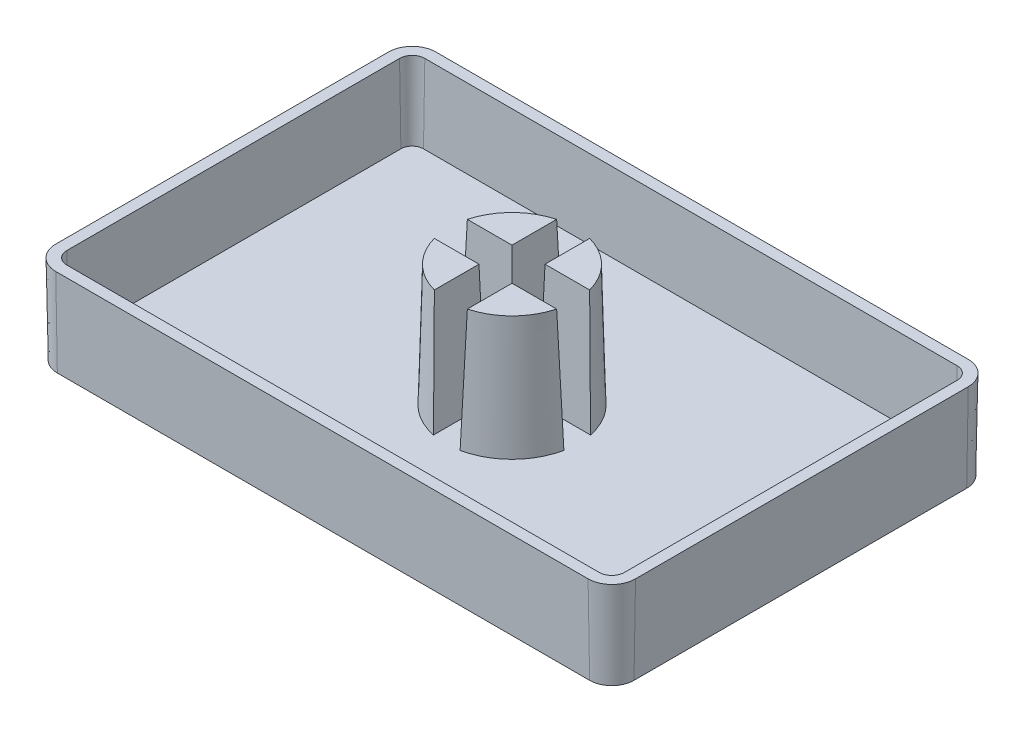
from build123d import *

# Parameters (mm, degrees)
BOSS_EXTRUDE1_DEPTH           = 4
BOSS_EXTRUDE1_DRAFT           = -1
SHELL1_T                      = -0.5
BOSS_EXTRUDE2_DEPTH           = 5.5
BOSS_EXTRUDE2_DRAFT           = 1.5
BOSS_EXTRUDE2_PROFILE_2_DEPTH = 5.5
BOSS_EXTRUDE2_PROFILE_2_DRAFT = 1.5
BOSS_EXTRUDE2_PROFILE_3_DEPTH = 5.5
BOSS_EXTRUDE2_PROFILE_3_DRAFT = 1.5
BOSS_EXTRUDE2_PROFILE_4_DEPTH = 5.5
BOSS_EXTRUDE2_PROFILE_4_DRAFT = 1.5


with BuildPart() as part:
    # Sketch1 → Boss-Extrude1 (with draft: the straight prism first)
    with BuildSketch(Plane(origin=(0, 0, 0), x_dir=(1, 0, 0), z_dir=(0, 1, 0))):
        with BuildLine():
            Line((-12, -8.5), (12, -8.5))
            ThreePointArc((12, -8.5), (12.707106781, -8.207106781), (13, -7.5))
            Line((13, -7.5), (13, 7.5))
            ThreePointArc((13, 7.5), (12.707106781, 8.207106781), (12, 8.5))
            Line((12, 8.5), (-12, 8.5))
            ThreePointArc((-12, 8.5), (-12.707106781, 8.207106781), (-13, 7.5))
            Line((-13, 7.5), (-13, -7.5))
            ThreePointArc((-13, -7.5), (-12.707106781, -8.207106781), (-12, -8.5))
        make_face()
    extrude(amount=BOSS_EXTRUDE1_DEPTH)
    # Boss-Extrude1: the draft: its side faces are tilted about the plane it starts from
    boss_extrude1_sides = [part.faces().sort_by_distance(p)[0] for p in [
        (0, 2, 8.5),
        (12.707106781, 2, 8.207106781),
        (13, 2, 0),
        (12.707106781, 2, -8.207106781),
        (0, 2, -8.5),
        (-12.707106781, 2, -8.207106781),
        (-13, 2, 0),
        (-12.707106781, 2, 8.207106781),
    ]]
    draft(boss_extrude1_sides, Plane(origin=(0, 0, 0), x_dir=(1, 0, 0), z_dir=(0, 1, 0)), BOSS_EXTRUDE1_DRAFT)

    # Shell1
    shell1_openings = [part.faces().sort_by_distance(p)[0] for p in [
        (0, 4, 0),
    ]]
    offset(amount=SHELL1_T, openings=shell1_openings, kind=Kind.INTERSECTION)


with BuildPart() as boss_extrude2_tool:
    # Sketch2 → Boss-Extrude2 (with draft: the straight prism first)
    with BuildSketch(Plane(origin=(0, 0.5, 0), x_dir=(1, 0, 0), z_dir=(0, 1, 0))):
        with BuildLine():
            Line((-0.6, -2.939387691), (-0.6, -0.6))
            Line((-0.6, -0.6), (-2.939387691, -0.6))
            ThreePointArc((-2.939387691, -0.6), (-2.121320344, -2.121320344), (-0.6, -2.939387691))
        make_face()
    extrude(amount=BOSS_EXTRUDE2_DEPTH)
    # Boss-Extrude2: the draft: its side faces are tilted about the plane it starts from
    boss_extrude2_sides = [boss_extrude2_tool.faces().sort_by_distance(p)[0] for p in [
        (-0.6, 3.25, 1.769693846),
        (-1.769693846, 3.25, 0.6),
        (-2.121320344, 3.25, 2.121320344),
    ]]
    draft(boss_extrude2_sides, Plane(origin=(0, 0.5, 0), x_dir=(1, 0, 0), z_dir=(0, 1, 0)), BOSS_EXTRUDE2_DRAFT)


with BuildPart() as part_1:
    add(part.part)

    # Boss-Extrude2: add boss_extrude2_tool
    add(boss_extrude2_tool.part)


with BuildPart() as boss_extrude2_profile_2_tool:
    # Sketch2 → Boss-Extrude2 profile 2 (with draft: the straight prism first)
    with BuildSketch(Plane(origin=(0, 0.5, 0), x_dir=(1, 0, 0), z_dir=(0, 1, 0))):
        with BuildLine():
            ThreePointArc((2.939387691, 0.6), (2.121320344, 2.121320344), (0.6, 2.939387691))
            Line((0.6, 2.939387691), (0.6, 0.6))
            Line((0.6, 0.6), (2.939387691, 0.6))
        make_face()
    extrude(amount=BOSS_EXTRUDE2_PROFILE_2_DEPTH)
    # Boss-Extrude2 profile 2: the draft: its side faces are tilted about the plane it starts from
    boss_extrude2_profile_2_sides = [boss_extrude2_profile_2_tool.faces().sort_by_distance(p)[0] for p in [
        (2.121320344, 3.25, -2.121320344),
        (0.6, 3.25, -1.769693846),
        (1.769693846, 3.25, -0.6),
    ]]
    draft(boss_extrude2_profile_2_sides, Plane(origin=(0, 0.5, 0), x_dir=(1, 0, 0), z_dir=(0, 1, 0)), BOSS_EXTRUDE2_PROFILE_2_DRAFT)


with BuildPart() as part_2:
    add(part_1.part)

    # Boss-Extrude2 profile 2: add boss_extrude2_profile_2_tool
    add(boss_extrude2_profile_2_tool.part)


with BuildPart() as boss_extrude2_profile_3_tool:
    # Sketch2 → Boss-Extrude2 profile 3 (with draft: the straight prism first)
    with BuildSketch(Plane(origin=(0, 0.5, 0), x_dir=(1, 0, 0), z_dir=(0, 1, 0))):
        with BuildLine():
            Line((2.939387691, -0.6), (0.6, -0.6))
            Line((0.6, -0.6), (0.6, -2.939387691))
            ThreePointArc((0.6, -2.939387691), (2.121320344, -2.121320344), (2.939387691, -0.6))
        make_face()
    extrude(amount=BOSS_EXTRUDE2_PROFILE_3_DEPTH)
    # Boss-Extrude2 profile 3: the draft: its side faces are tilted about the plane it starts from
    boss_extrude2_profile_3_sides = [boss_extrude2_profile_3_tool.faces().sort_by_distance(p)[0] for p in [
        (1.769693846, 3.25, 0.6),
        (0.6, 3.25, 1.769693846),
        (2.121320344, 3.25, 2.121320344),
    ]]
    draft(boss_extrude2_profile_3_sides, Plane(origin=(0, 0.5, 0), x_dir=(1, 0, 0), z_dir=(0, 1, 0)), BOSS_EXTRUDE2_PROFILE_3_DRAFT)


with BuildPart() as part_3:
    add(part_2.part)

    # Boss-Extrude2 profile 3: add boss_extrude2_profile_3_tool
    add(boss_extrude2_profile_3_tool.part)


with BuildPart() as boss_extrude2_profile_4_tool:
    # Sketch2 → Boss-Extrude2 profile 4 (with draft: the straight prism first)
    with BuildSketch(Plane(origin=(0, 0.5, 0), x_dir=(1, 0, 0), z_dir=(0, 1, 0))):
        with BuildLine():
            Line((-0.6, 0.6), (-0.6, 2.939387691))
            ThreePointArc((-0.6, 2.939387691), (-2.121320344, 2.121320344), (-2.939387691, 0.6))
            Line((-2.939387691, 0.6), (-0.6, 0.6))
        make_face()
    extrude(amount=BOSS_EXTRUDE2_PROFILE_4_DEPTH)
    # Boss-Extrude2 profile 4: the draft: its side faces are tilted about the plane it starts from
    boss_extrude2_profile_4_sides = [boss_extrude2_profile_4_tool.faces().sort_by_distance(p)[0] for p in [
        (-1.769693846, 3.25, -0.6),
        (-0.6, 3.25, -1.769693846),
        (-2.121320344, 3.25, -2.121320344),
    ]]
    draft(boss_extrude2_profile_4_sides, Plane(origin=(0, 0.5, 0), x_dir=(1, 0, 0), z_dir=(0, 1, 0)), BOSS_EXTRUDE2_PROFILE_4_DRAFT)


with BuildPart() as part_4:
    add(part_3.part)

    # Boss-Extrude2 profile 4: add boss_extrude2_profile_4_tool
    add(boss_extrude2_profile_4_tool.part)


solid = part_4.part
